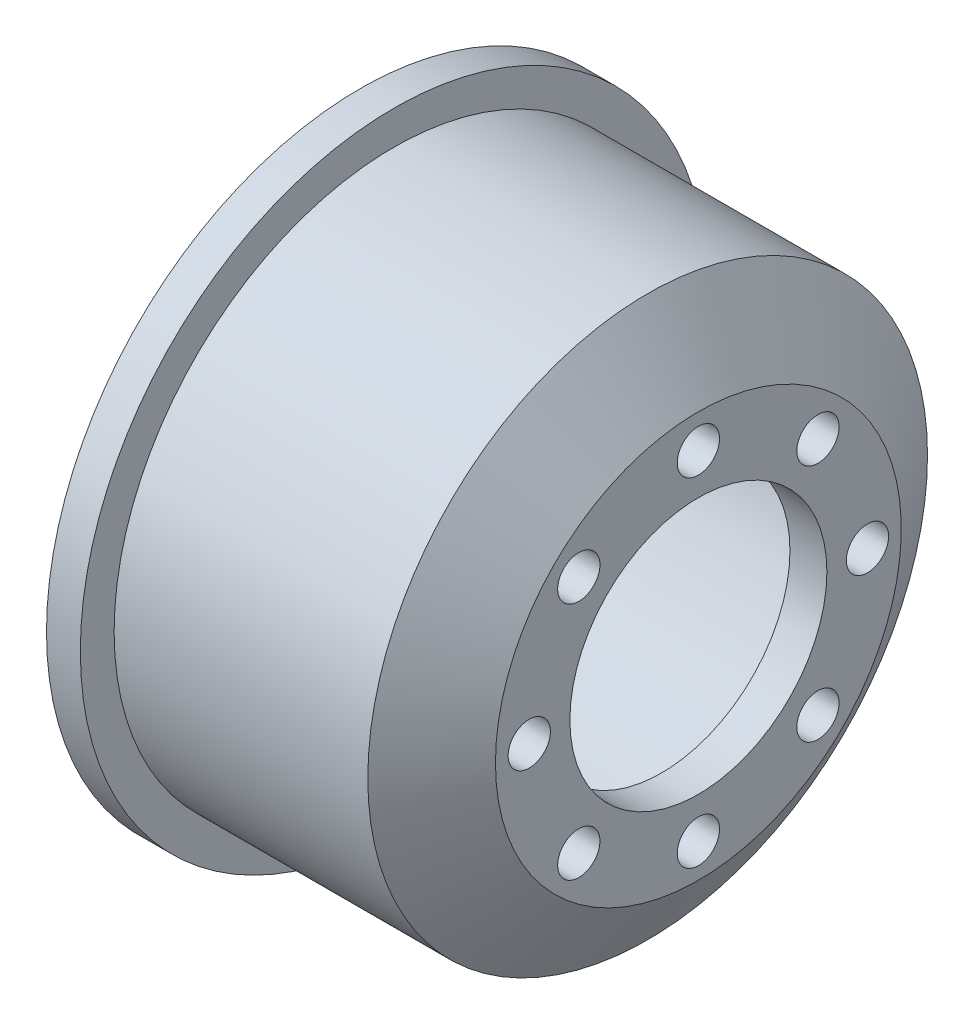
from build123d import *

# Parameters (mm, degrees)
SKETCH11_R         = 1.25
CUT_EXTRUDE9_DEPTH = 33.987952346


with BuildPart() as part:
    # Sketch1 → Revolve1 (revolve)
    with BuildSketch(Plane(origin=(0, 0, 0), x_dir=(1, 0, 0), z_dir=(0, 1, 0))):
        Polygon((12.139813159, 7.6), (12.139813159, 12), (9.139813159, 16.55), (-5.860186841, 16.55), (-5.860186841, 18.55), (-7.360186841, 18.55), (-7.860186841, 18.55), (-7.860186841, 17.55), (-7.360186841, 17.55), (-7.360186841, 16.55), (-7.360186841, 14.55), (7.870310221, 14.55), (9.956478853, 11.385977576), (9.956478853, 7.6), align=None)
    revolve(axis=Axis((-37.278866169, 0, 0), (1, 0, 0)))

    # Sketch11 → Cut-Extrude9 (cut, through all)
    with BuildSketch(Plane(origin=(12.139813159, 0, 0), x_dir=(0, 0, -1), z_dir=(1, 0, 0))):
        with Locations((0, 10)):
            Circle(SKETCH11_R)
        with Locations((7.071067812, 7.071067812)):
            Circle(SKETCH11_R)
        with Locations((10, 0)):
            Circle(SKETCH11_R)
        with Locations((7.071067812, -7.071067812)):
            Circle(SKETCH11_R)
        with Locations((0, -10)):
            Circle(SKETCH11_R)
        with Locations((-7.071067812, -7.071067812)):
            Circle(SKETCH11_R)
        with Locations((-10, 0)):
            Circle(SKETCH11_R)
        with Locations((-7.071067812, 7.071067812)):
            Circle(SKETCH11_R)
    extrude(amount=-CUT_EXTRUDE9_DEPTH, mode=Mode.SUBTRACT)


solid = part.part
